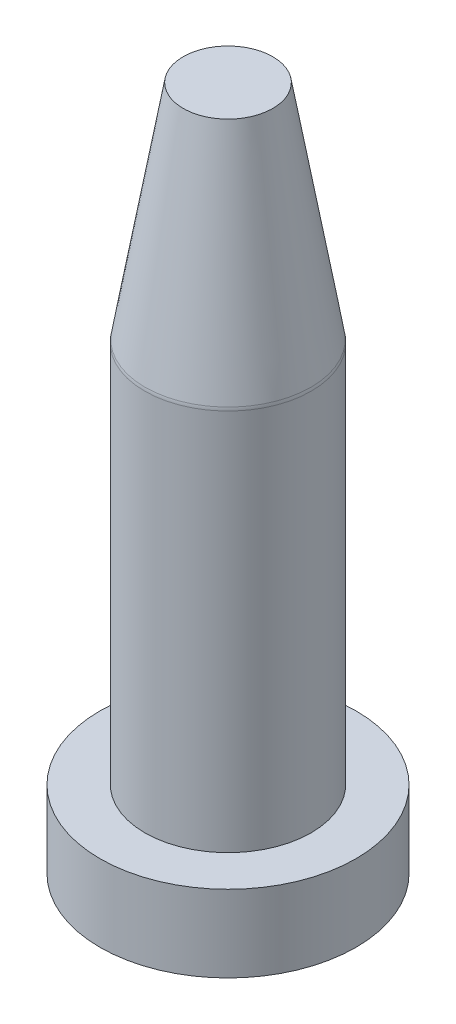
from build123d import *

# Parameters (mm, degrees)
FILLET_1_R = 3


with BuildPart() as part:
    # 草图1 → Revolve 297 (revolve)
    with BuildSketch(Plane.XY):
        Polygon((0, 0), (20, 0), (20, 12), (13, 12), (13, 72), (7, 107), (0, 107), align=None)
    revolve(axis=Axis((0, 0, 0), (0, 1, 0)))

    # 圆角1
    fillet_1_edges = [part.edges().sort_by_distance(p)[0] for p in [
        (-13, 72, 0),
    ]]
    fillet(fillet_1_edges, radius=FILLET_1_R)


solid = part.part
